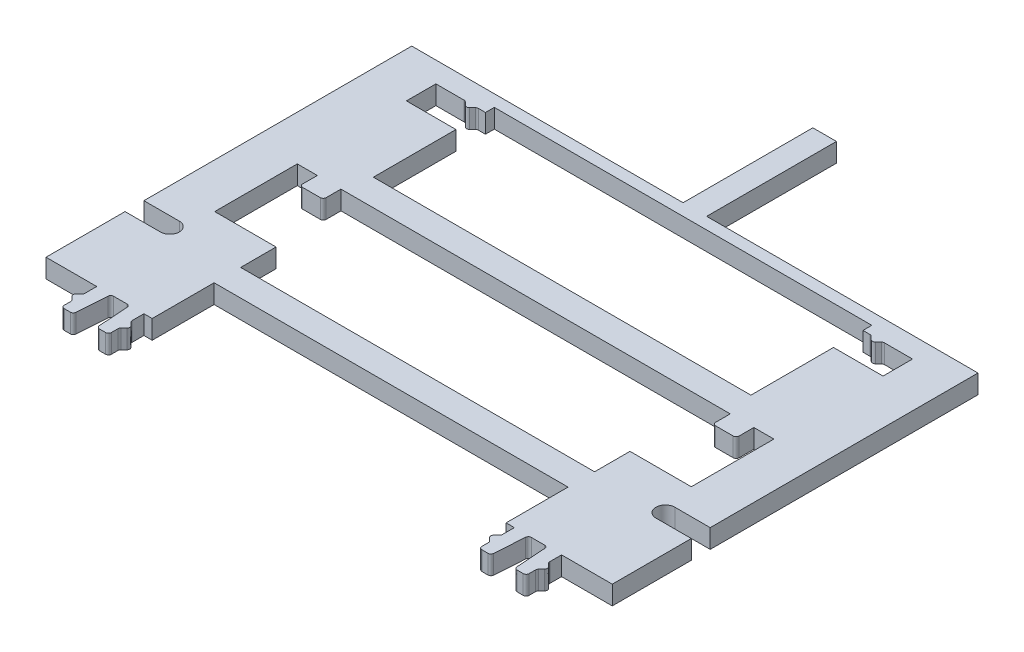
from build123d import *

# Parameters (mm, degrees)
BOSS_EXTRUDE1_DEPTH = 1.6


with BuildPart() as part:
    # Sketch1 → Boss-Extrude1 (new body)
    with BuildSketch(Plane(origin=(0, 0, 0), x_dir=(1, 0, 0), z_dir=(0, 1, 0))):
        with BuildLine():
            Line((-68.929583289, 0), (-64.629583289, 0))
            Line((-64.629583289, 0), (-64.629583289, -0.996446609))
            ThreePointArc((-64.629583289, -0.996446609), (-64.648613406, -1.092117467), (-64.702806594, -1.173223305))
            Line((-64.702806594, -1.173223305), (-64.952806594, -1.423223305))
            ThreePointArc((-64.952806594, -1.423223305), (-65.026029899, -1.6), (-64.952806594, -1.776776695))
            Line((-64.952806594, -1.776776695), (-64.702806594, -2.026776695))
            ThreePointArc((-64.702806594, -2.026776695), (-64.648613406, -2.107882533), (-64.629583289, -2.203553391))
            Line((-64.629583289, -2.203553391), (-64.629583289, -2.75))
            ThreePointArc((-64.629583289, -2.75), (-64.556359984, -2.926776695), (-64.379583289, -3))
            Line((-64.379583289, -3), (-63.863471562, -3))
            ThreePointArc((-63.863471562, -3), (-63.692675541, -2.932561549), (-63.614025273, -2.766629753))
            Line((-63.614025273, -2.766629753), (-63.445141306, -0.233370247))
            ThreePointArc((-63.445141306, -0.233370247), (-63.366491038, -0.067438451), (-63.195695016, 0))
            Line((-63.195695016, 0), (-62.063471562, 0))
            ThreePointArc((-62.063471562, 0), (-61.892675541, -0.067438451), (-61.814025273, -0.233370247))
            Line((-61.814025273, -0.233370247), (-61.645141306, -2.766629753))
            ThreePointArc((-61.645141306, -2.766629753), (-61.566491038, -2.932561549), (-61.395695016, -3))
            Line((-61.395695016, -3), (-60.879583289, -3))
            ThreePointArc((-60.879583289, -3), (-60.702806594, -2.926776695), (-60.629583289, -2.75))
            Line((-60.629583289, -2.75), (-60.629583289, -2.203553391))
            ThreePointArc((-60.629583289, -2.203553391), (-60.610553172, -2.107882533), (-60.556359984, -2.026776695))
            Line((-60.556359984, -2.026776695), (-60.306359984, -1.776776695))
            ThreePointArc((-60.306359984, -1.776776695), (-60.23313668, -1.6), (-60.306359984, -1.423223305))
            Line((-60.306359984, -1.423223305), (-60.556359984, -1.173223305))
            ThreePointArc((-60.556359984, -1.173223305), (-60.610553172, -1.092117467), (-60.629583289, -0.996446609))
            Line((-60.629583289, -0.996446609), (-60.629583289, 0))
            Line((-60.629583289, 0), (-59.929583289, 0))
            Line((-59.929583289, 0), (-59.929583289, 5.25))
            Line((-59.929583289, 5.25), (-44.929583289, 5.25))
            Line((-44.929583289, 5.25), (-44.929583289, 7.5))
            Line((-44.929583289, 7.5), (-59.929583289, 7.5))
            Line((-59.929583289, 7.5), (-59.929583289, 10.5))
            Line((-59.929583289, 10.5), (-65.129583289, 10.5))
            Line((-65.129583289, 10.5), (-65.129583289, 17.5))
            Line((-65.129583289, 17.5), (-63.429583289, 17.5))
            Line((-63.429583289, 17.5), (-63.429583289, 16.25))
            ThreePointArc((-63.429583289, 16.25), (-63.356359984, 16.073223305), (-63.179583289, 16))
            Line((-63.179583289, 16), (-61.679583289, 16))
            ThreePointArc((-61.679583289, 16), (-61.502806594, 16.073223305), (-61.429583289, 16.25))
            Line((-61.429583289, 16.25), (-61.429583289, 17.5))
            Line((-61.429583289, 17.5), (-44.929583289, 17.5))
            Line((-44.929583289, 17.5), (-44.929583289, 19.75))
            Line((-44.929583289, 19.75), (-60.929583289, 19.75))
            Line((-60.929583289, 19.75), (-60.929583289, 26.75))
            Line((-60.929583289, 26.75), (-65.129583289, 26.75))
            Line((-65.129583289, 26.75), (-65.129583289, 29.25))
            Line((-65.129583289, 29.25), (-62.73313668, 29.25))
            ThreePointArc((-62.73313668, 29.25), (-62.637465822, 29.230969883), (-62.556359984, 29.176776695))
            Line((-62.556359984, 29.176776695), (-62.306359984, 28.926776695))
            ThreePointArc((-62.306359984, 28.926776695), (-62.129583289, 28.853553391), (-61.952806594, 28.926776695))
            Line((-61.952806594, 28.926776695), (-61.702806594, 29.176776695))
            ThreePointArc((-61.702806594, 29.176776695), (-61.621700757, 29.230969883), (-61.526029899, 29.25))
            Line((-61.526029899, 29.25), (-60.929583289, 29.25))
            Line((-60.929583289, 29.25), (-60.929583289, 30))
            Line((-60.929583289, 30), (-44.929583289, 30))
            Line((-44.929583289, 30), (-44.929583289, 42))
            Line((-44.929583289, 42), (-45.929583289, 42))
            Line((-45.929583289, 42), (-45.929583289, 31))
            Line((-45.929583289, 31), (-68.929583289, 31))
            Line((-68.929583289, 31), (-68.929583289, 20))
            Line((-68.929583289, 20), (-68.929583289, 8.3))
            Line((-68.929583289, 8.3), (-65.929583289, 8.3))
            ThreePointArc((-65.929583289, 8.3), (-65.129583289, 7.5), (-65.929583289, 6.7))
            Line((-65.929583289, 6.7), (-68.929583289, 6.7))
            Line((-68.929583289, 6.7), (-68.929583289, 0))
        make_face()
    boss_extrude1 = extrude(amount=BOSS_EXTRUDE1_DEPTH)

    # Mirror1: Boss-Extrude1 across plane
    add(boss_extrude1.mirror(Plane(origin=(-44.929583289, 1.6, -42), x_dir=(0, 0, 1), z_dir=(-1, 0, 0))))


solid = part.part
